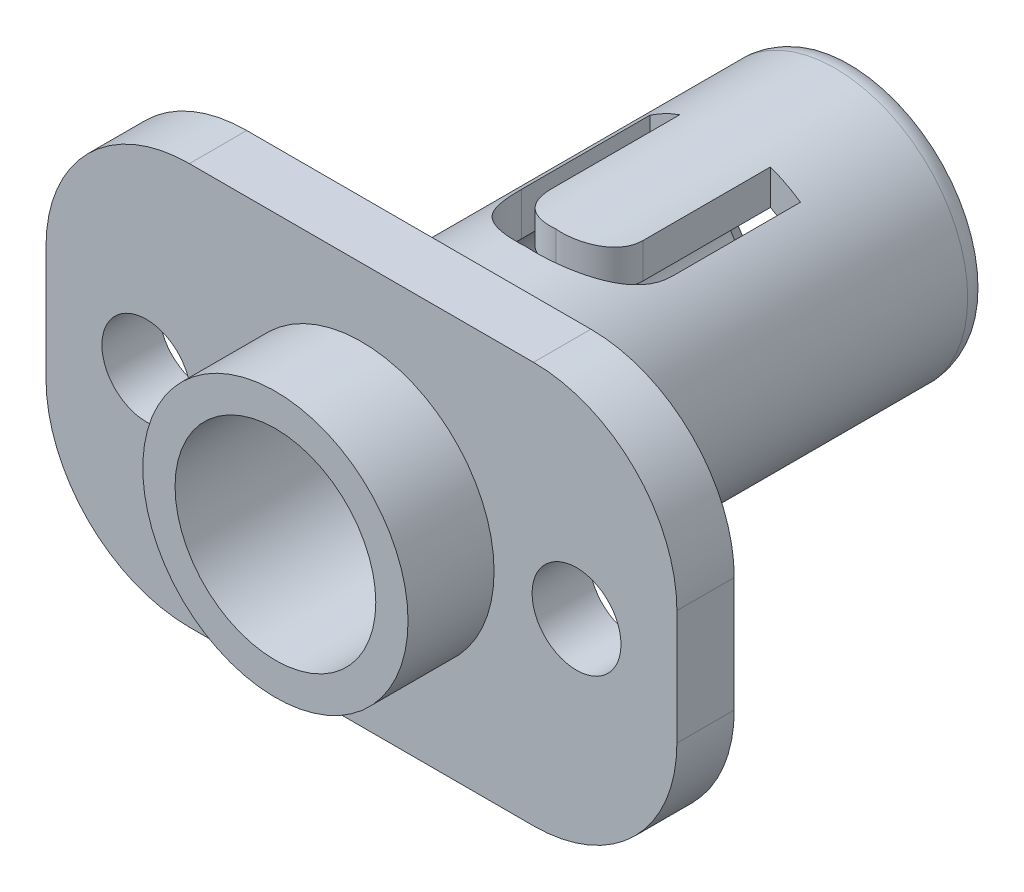
from build123d import *

# Parameters (mm, degrees)
ESQUISSE1_W               = 22
ESQUISSE1_H               = 14
BOSS_EXTRU_1_DEPTH        = 2
ESQUISSE3_R               = 4.625
ESQUISSE3_R_2             = 3.5
BOSS_EXTRU_2_DEPTH        = 15
BOSS_EXTRU_3_START        = 3
ESQUISSE5_R               = 4.625
BOSS_EXTRU_3_DEPTH        = 3
ESQUISSE4_R               = 3.5
ENL_V_MAT_EXTRU_1_DEPTH   = 24.243966888
ENL_V_MAT_EXTRU_2_DEPTH   = 21.826081473
CONG_1_R                  = 5
D_GAGEMENT_M2_51_D        = 3.1
D_GAGEMENT_M2_51_DEPTH    = 18.17
D_GAGEMENT_M2_51_TIP      = 0.931333959
CHANFREIN1_SIZE           = 1
CONG_2_R                  = 1
ESQUISSE12_R              = 1.5
BOSS_EXTRU_4_DEPTH        = 1.35
BOSS_EXTRU_4_DRAFT        = -32
SYM_TRIE2_COPY_1_SKETCH_R = 1.5
SYM_TRIE2_COPY_1_DEPTH    = 1.35
SYM_TRIE2_COPY_1_DRAFT    = -32


with BuildPart() as part:
    # Esquisse1 → Boss.-Extru.1 (new body)
    with BuildSketch(Plane.XY):
        with Locations((-1.638262124, 5.472222222)):
            Rectangle(ESQUISSE1_W, ESQUISSE1_H)
    extrude(amount=BOSS_EXTRU_1_DEPTH)

    # Esquisse3 → Boss.-Extru.2 (add)
    with BuildSketch(Plane(origin=(0, 0, 0), x_dir=(-1, 0, 0), z_dir=(0, 0, -1))):
        with Locations(Location((1.638262124, 5.472222222, 0), (0, 0, 180))):
            Circle(ESQUISSE3_R)
        with Locations((1.638262124, 5.472222222)):
            Circle(ESQUISSE3_R_2, mode=Mode.SUBTRACT)
    extrude(amount=BOSS_EXTRU_2_DEPTH)

    # Esquisse5 → Boss.-Extru.3 (add)
    with BuildSketch(Plane.XY.offset(2).offset(BOSS_EXTRU_3_START)):
        with Locations((-1.638262124, 5.472222222)):
            Circle(ESQUISSE5_R)
    extrude(amount=-BOSS_EXTRU_3_DEPTH)

    # Esquisse4 → Enlèv. mat.-Extru.1 (cut, through all)
    with BuildSketch(Plane(origin=(0, 0, 0), x_dir=(-1, 0, 0), z_dir=(0, 0, -1))):
        with Locations((1.638262124, 5.472222222)):
            Circle(ESQUISSE4_R)
    extrude(amount=-ENL_V_MAT_EXTRU_1_DEPTH, mode=Mode.SUBTRACT)

    # Esquisse6 → Enlèv. mat.-Extru.2 (cut, symmetric)
    with BuildSketch(Plane(origin=(0, 5.472222222, 0), x_dir=(-1, 0, 0), z_dir=(0, -1, 0))):
        with BuildLine():
            Line((3.21697524, 10.683041), (4.265016312, 10.683041))
            Line((4.265016312, 10.683041), (4.265016312, 6.204978645))
            ThreePointArc((4.265016312, 6.204978645), (3.485411067, 4.403002531), (1.638262124, 3.737462868))
            Line((1.638262124, 3.737462868), (1.638262124, 4.790102764))
            ThreePointArc((1.638262124, 4.790102764), (2.74581304, 5.165435363), (3.21697524, 6.235738952))
            Line((3.21697524, 6.235738952), (3.21697524, 10.683041))
        make_face()
    enl_v_mat_extru_2 = extrude(amount=ENL_V_MAT_EXTRU_2_DEPTH, both=True, mode=Mode.SUBTRACT)

    # Symétrie1: Enlèv. mat.-Extru.2 across plane
    add(enl_v_mat_extru_2.mirror(Plane.ZY.offset(1.638262124)), mode=Mode.SUBTRACT)

    # Congé1
    cong_1_edges = [part.edges().sort_by_distance(p)[0] for p in [
        (-12.638262124, 12.472222222, 1),
        (9.361737876, 12.472222222, 1),
        (9.361737876, -1.527777778, 1),
        (-12.638262124, -1.527777778, 1),
    ]]
    fillet(cong_1_edges, radius=CONG_1_R)

    # Dégagement M2.51
    with Locations(Plane(origin=(0, 0, 0), x_dir=(-1, 0, 0), z_dir=(0, 0, -1))):
        with Locations((-5.861737876, 5.472222222), (9.138262124, 5.472222222)):
            Hole(D_GAGEMENT_M2_51_D / 2, depth=D_GAGEMENT_M2_51_DEPTH)
            with Locations((0, 0, -(D_GAGEMENT_M2_51_DEPTH + D_GAGEMENT_M2_51_TIP / 2))):  # 118° drill point
                Cone(0, D_GAGEMENT_M2_51_D / 2, D_GAGEMENT_M2_51_TIP, mode=Mode.SUBTRACT)

    # Chanfrein1
    chanfrein1_edges = [part.edges().sort_by_distance(p)[0] for p in [
        (1.861737876, 5.472222222, -15),
    ]]
    chamfer(chanfrein1_edges, length=CHANFREIN1_SIZE)

    # Congé2
    # the kernel refuses this fillet: 1 mm, written as the material it takes off along each edge
    with BuildSketch(Plane(origin=(-1.638262124, 5.472222222, -15), x_dir=(1, 0, 0), z_dir=(0, 1, 0))) as cong_2_piece_1:
        with BuildLine():
            CenterArc((3.625, -0.484122918), CONG_2_R, 0, 28.955024372)
            Line((4.625, -0.484122918), (4.645, -0.484122918))
            Line((4.645, -0.484122918), (4.645, 0))
            Line((4.645, 0), (4.625, 0.02))
            ThreePointArc((4.625, 0.02), (4.5625, 0.02), (4.5175, 0.009682458))
            Line((4.5175, 0.009682458), (4.5, 0))
        make_face()
    revolve(axis=Axis((-1.638262124, 5.472222222, -15), (0, 0, -1)), mode=Mode.SUBTRACT)


with BuildPart() as boss_extru_4_tool:
    # Esquisse12 → Boss.-Extru.4 (with draft: the straight prism first)
    with BuildSketch(Plane(origin=(0, 1.972222222, 0), x_dir=(-1, 0, 0), z_dir=(0, -1, 0))):
        with Locations((1.626150822, 6.5)):
            Circle(ESQUISSE12_R)
    extrude(amount=-BOSS_EXTRU_4_DEPTH)
    # Boss.-Extru.4: the draft: its side faces are tilted about the plane it starts from
    boss_extru_4_sides = [boss_extru_4_tool.faces().sort_by_distance(p)[0] for p in [
        (-0.126150822, 2.647222222, -6.5),
    ]]
    draft(boss_extru_4_sides, Plane(origin=(0, 1.972222222, 0), x_dir=(-1, 0, 0), z_dir=(0, -1, 0)), BOSS_EXTRU_4_DRAFT)


with BuildPart() as part_1:
    add(part.part)

    # Boss.-Extru.4: add boss_extru_4_tool
    add(boss_extru_4_tool.part)


with BuildPart() as sym_trie2_copy_1_tool:
    # Symétrie2 copy 1 sketch → Symétrie2 copy 1 (with draft: the straight prism first)
    with BuildSketch(Plane(origin=(0, 8.972222222, 0), x_dir=(-1, 0, 0), z_dir=(0, 1, 0))):
        with Locations((1.626150822, -6.5)):
            Circle(SYM_TRIE2_COPY_1_SKETCH_R)
    extrude(amount=-SYM_TRIE2_COPY_1_DEPTH)
    # Symétrie2 copy 1: the draft: its side faces are tilted about the plane it starts from
    sym_trie2_copy_1_sides = [sym_trie2_copy_1_tool.faces().sort_by_distance(p)[0] for p in [
        (-0.126150822, 8.297222222, -6.5),
    ]]
    draft(sym_trie2_copy_1_sides, Plane(origin=(0, 8.972222222, 0), x_dir=(-1, 0, 0), z_dir=(0, 1, 0)), SYM_TRIE2_COPY_1_DRAFT)


with BuildPart() as part_2:
    add(part_1.part)

    # Symétrie2 copy 1: add sym_trie2_copy_1_tool
    add(sym_trie2_copy_1_tool.part)


solid = part_2.part
